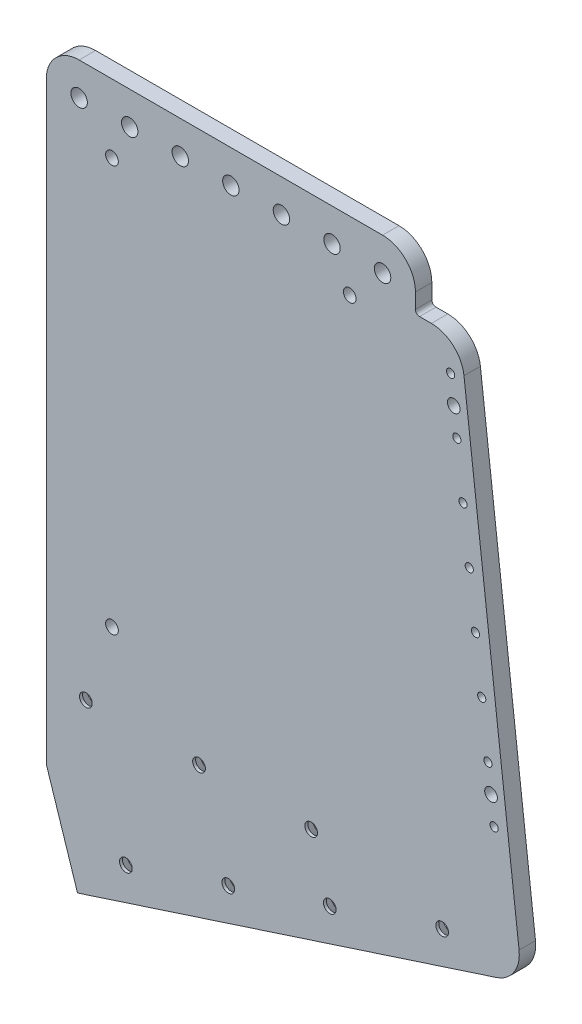
from build123d import *

# Parameters (mm, degrees)
BOSS_EXTRUDE1_DEPTH                           = 6.35
FILLET1_R                                     = 12.7
CUT_EXTRUDE1_DEPTH                            = 359.249441289
CSK_FOR_8_FLAT_HEAD_MACHINE_SCREW1_AT_2_COUNT = 2
CSK_FOR_8_FLAT_HEAD_MACHINE_SCREW1_AT_2_PITCH = 41.643335968
CSK_FOR_8_FLAT_HEAD_MACHINE_SCREW1_AT_3_COUNT = 2
CSK_FOR_8_FLAT_HEAD_MACHINE_SCREW1_AT_3_PITCH = 55.434622241
CSK_FOR_8_FLAT_HEAD_MACHINE_SCREW1_AT_4_COUNT = 2
CSK_FOR_8_FLAT_HEAD_MACHINE_SCREW1_AT_4_PITCH = 50.008853946
CSK_FOR_8_FLAT_HEAD_MACHINE_SCREW1_AT_5_COUNT = 2
CSK_FOR_8_FLAT_HEAD_MACHINE_SCREW1_AT_5_PITCH = 82.918335968
CSK_FOR_8_FLAT_HEAD_MACHINE_SCREW1_AT_6_COUNT = 2
CSK_FOR_8_FLAT_HEAD_MACHINE_SCREW1_AT_6_PITCH = 86.127052655
CSK_FOR_8_FLAT_HEAD_MACHINE_SCREW1_AT_7_COUNT = 2
CSK_FOR_8_FLAT_HEAD_MACHINE_SCREW1_AT_7_PITCH = 128.617381968
F_1_8_0_125_DIAMETER_HOLE1_D                  = 3.175
F_8_CLEARANCE_HOLE1_D                         = 4.9149
F_1_4_0_25_DIAMETER_HOLE1_D                   = 6.35
F_8_CLEARANCE_HOLE2_D                         = 4.9149
F_8_CLEARANCE_HOLE3_D                         = 4.9149
FILLET2_R                                     = 1.5875


with BuildPart() as part:
    # Sketch1 → Boss-Extrude1 (new body)
    with BuildSketch(Plane.XY):
        Polygon((-234.752967181, 12.7), (-91.997327393, 12.7), (-91.997327393, -7.416979032), (-74.533465131, -7.416979032), (-50.700252483, -210.6746006), (-234.752967181, -270.542758328), align=None)
    extrude(amount=BOSS_EXTRUDE1_DEPTH)

    # Fillet1
    fillet1_edges = [part.edges().sort_by_distance(p)[0] for p in [
        (-74.533465131, -7.416979032, 3.175),
        (-50.700252483, -210.6746006, 3.175),
        (-234.752967181, 12.7, 3.175),
        (-91.997327393, 12.7, 3.175),
    ]]
    fillet(fillet1_edges, radius=FILLET1_R)

    # Sketch2 → Cut-Extrude1 (cut, through all)
    with BuildSketch(Plane.XY.offset(6.35)):
        Polygon((-234.752967181, -270.542758328), (-222.67581909, -266.614337017), (-234.752967181, -229.485553098), align=None)
    extrude(amount=-CUT_EXTRUDE1_DEPTH, mode=Mode.SUBTRACT)

    # Sketch4 → CSK for #8 Flat Head Machine Screw1 (revolve, cut)
    with BuildSketch(Plane(origin=(-203.96982343, -247.917009556, 0), x_dir=(0, 1, 0), z_dir=(1, 0, 0))):
        Polygon((0, 0), (0, 6.35), (2.45745, 6.35), (2.45745, 5.19844512), (6.9763894, 0), align=None)
    csk_for_8_flat_head_machine_screw1 = revolve(axis=Axis((-203.96982343, -247.917009556, -6.35), (0, 0, 1)), mode=Mode.SUBTRACT)

    # CSK for #8 Flat Head Machine Screw1 at 2: CSK for #8 Flat Head Machine Screw1 ×2
    with Locations(*[Vector(0.9509565425677294, 0.30932451268470523, 0) * (i * CSK_FOR_8_FLAT_HEAD_MACHINE_SCREW1_AT_2_PITCH) for i in range(1, CSK_FOR_8_FLAT_HEAD_MACHINE_SCREW1_AT_2_COUNT)]):
        add(csk_for_8_flat_head_machine_screw1, mode=Mode.SUBTRACT)

    # CSK for #8 Flat Head Machine Screw1 at 3: CSK for #8 Flat Head Machine Screw1 ×2
    with Locations(*[Vector(0.5102012076622674, 0.8600550724808057, 0) * (i * CSK_FOR_8_FLAT_HEAD_MACHINE_SCREW1_AT_3_PITCH) for i in range(1, CSK_FOR_8_FLAT_HEAD_MACHINE_SCREW1_AT_3_COUNT)]):
        add(csk_for_8_flat_head_machine_screw1, mode=Mode.SUBTRACT)

    # CSK for #8 Flat Head Machine Screw1 at 4: CSK for #8 Flat Head Machine Screw1 ×2
    with Locations(*[Vector(-0.3093245126849687, 0.9509565425676436, 0) * (i * CSK_FOR_8_FLAT_HEAD_MACHINE_SCREW1_AT_4_PITCH) for i in range(1, CSK_FOR_8_FLAT_HEAD_MACHINE_SCREW1_AT_4_COUNT)]):
        add(csk_for_8_flat_head_machine_screw1, mode=Mode.SUBTRACT)

    # CSK for #8 Flat Head Machine Screw1 at 5: CSK for #8 Flat Head Machine Screw1 ×2
    with Locations(*[Vector(0.9509565425676433, 0.30932451268496985, 0) * (i * CSK_FOR_8_FLAT_HEAD_MACHINE_SCREW1_AT_5_PITCH) for i in range(1, CSK_FOR_8_FLAT_HEAD_MACHINE_SCREW1_AT_5_COUNT)]):
        add(csk_for_8_flat_head_machine_screw1, mode=Mode.SUBTRACT)

    # CSK for #8 Flat Head Machine Screw1 at 6: CSK for #8 Flat Head Machine Screw1 ×2
    with Locations(*[Vector(0.8318826599155766, 0.5549515655728751, 0) * (i * CSK_FOR_8_FLAT_HEAD_MACHINE_SCREW1_AT_6_PITCH) for i in range(1, CSK_FOR_8_FLAT_HEAD_MACHINE_SCREW1_AT_6_COUNT)]):
        add(csk_for_8_flat_head_machine_screw1, mode=Mode.SUBTRACT)

    # CSK for #8 Flat Head Machine Screw1 at 7: CSK for #8 Flat Head Machine Screw1 ×2
    with Locations(*[Vector(0.9509565425676432, 0.30932451268497024, 0) * (i * CSK_FOR_8_FLAT_HEAD_MACHINE_SCREW1_AT_7_PITCH) for i in range(1, CSK_FOR_8_FLAT_HEAD_MACHINE_SCREW1_AT_7_COUNT)]):
        add(csk_for_8_flat_head_machine_screw1, mode=Mode.SUBTRACT)

    # 1/8 (0.125) Diameter Hole1 (through all)
    with Locations(Plane.XY.offset(6.35)):
        with Locations((-78.378649341, -20.425753498), (-75.97524073, -40.922827272), (-73.571832119, -61.419901046), (-71.168423508, -81.91697482), (-68.765014897, -102.414048594), (-66.361606286, -122.911122368), (-63.958197675, -143.408196142), (-61.554789065, -163.905269916)):
            Hole(F_1_8_0_125_DIAMETER_HOLE1_D / 2)

    # #8 Clearance Hole1 (through all)
    with Locations(Plane.XY.offset(6.35)):
        with Locations((-77.176945035, -30.674290385), (-62.75649337, -153.656733029)):
            Hole(F_8_CLEARANCE_HOLE1_D / 2)

    # 1/4 (0.25) Diameter Hole1 (through all)
    with Locations(Plane.XY.offset(6.35)):
        with Locations((-104.697327393, 0), (-124.256600695, 0), (-143.815873997, 0), (-163.375147299, 0), (-182.934420601, 0), (-202.493693903, 0), (-222.052967205, 0)):
            Hole(F_1_4_0_25_DIAMETER_HOLE1_D / 2)

    # #8 Clearance Hole2 (through all)
    with Locations(Plane.XY.offset(6.35)):
        with Locations((-117.397327393, -13.766979032), (-209.352967181, -13.766979032)):
            Hole(F_8_CLEARANCE_HOLE2_D / 2)

    # #8 Clearance Hole3 (through all)
    with Locations(Plane.XY.offset(6.35)):
        with Locations((-209.352967181, -170.846075828)):
            Hole(F_8_CLEARANCE_HOLE3_D / 2)

    # Fillet2
    fillet2_edges = [part.edges().sort_by_distance(p)[0] for p in [
        (-91.997327393, -7.416979032, 3.175),
    ]]
    fillet(fillet2_edges, radius=FILLET2_R)


solid = part.part
